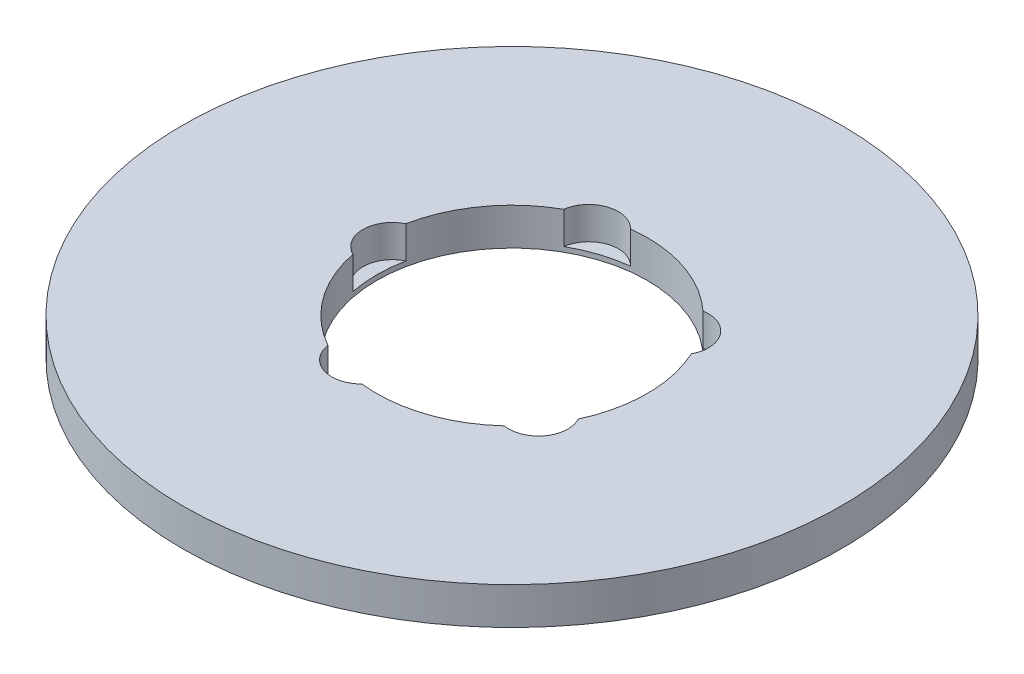
from build123d import *

# Parameters (mm, degrees)
SKETCH1_R           = 97.5
BOSS_EXTRUDE1_DEPTH = 11
SKETCH2_R           = 40
CUT_EXTRUDE1_DEPTH  = 139.32389526
SKETCH3_R           = 8.724273979
CUT_EXTRUDE2_DEPTH  = 9.547008799
CIRPATTERN1_COUNT   = 5


with BuildPart() as part:
    # Sketch1 → Boss-Extrude1 (new body)
    with BuildSketch(Plane(origin=(0, 0, 0), x_dir=(1, 0, 0), z_dir=(0, 1, 0))):
        Circle(SKETCH1_R)
    extrude(amount=BOSS_EXTRUDE1_DEPTH)

    # Sketch2 → Cut-Extrude1 (cut, through all)
    with BuildSketch(Plane(origin=(0, 0, 0), x_dir=(1, 0, 0), z_dir=(0, 1, 0))):
        Circle(SKETCH2_R)
    extrude(amount=CUT_EXTRUDE1_DEPTH, mode=Mode.SUBTRACT)

    # Sketch3 → Cut-Extrude2 (cut)
    with BuildSketch(Plane(origin=(0, 11, 0), x_dir=(1, 0, 0), z_dir=(0, 1, 0))):
        with Locations((-35.386647622, 0)):
            Circle(SKETCH3_R)
    cut_extrude2 = extrude(amount=-CUT_EXTRUDE2_DEPTH, mode=Mode.SUBTRACT)

    # CirPattern1: Cut-Extrude2 ×5 about axis
    cirpattern1_axis = Axis((0, 0, 0), (0, 1, 0))
    for i in range(1, CIRPATTERN1_COUNT):
        add(cut_extrude2.rotate(cirpattern1_axis, i * 360 / CIRPATTERN1_COUNT), mode=Mode.SUBTRACT)


solid = part.part
